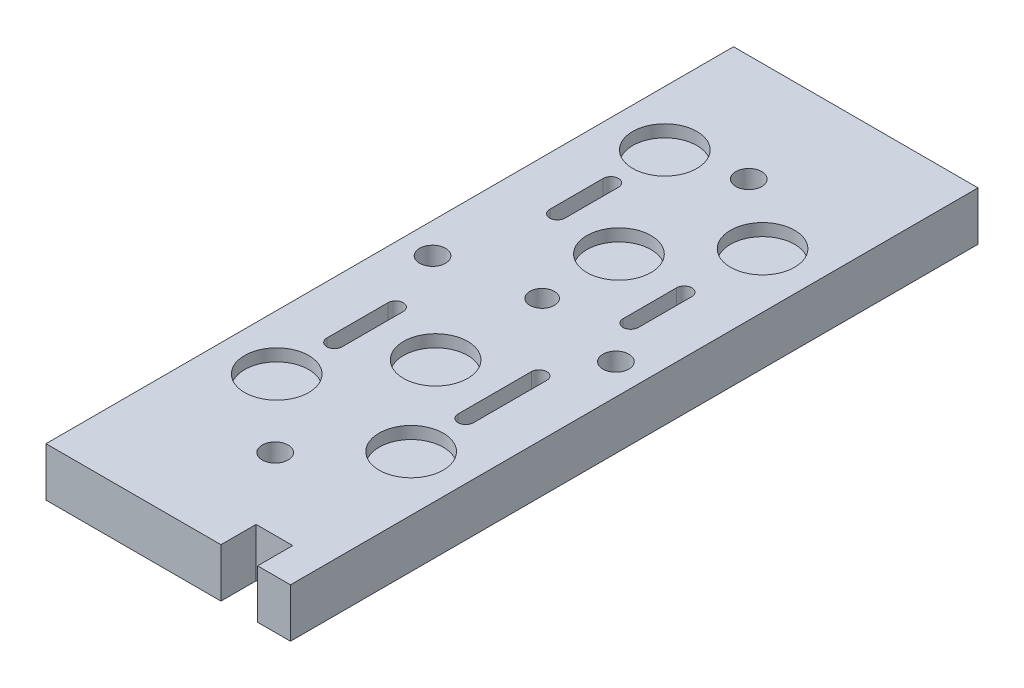
from build123d import *

# Parameters (mm, degrees)
SKETCH1_W           = 80
SKETCH1_H           = 225
BOSS_EXTRUDE1_DEPTH = 16
CUT_EXTRUDE1_REACH  = 122.467
SKETCH4_R           = 10.5
CUT_EXTRUDE2_DEPTH  = 4
SKETCH5_R           = 8.5
CUT_EXTRUDE3_DEPTH  = 5
CUT_EXTRUDE4_REACH  = 122.467
SKETCH6_W           = 12
SKETCH6_H           = 11.5
M10_TAPPED_HOLE1_D  = 8.5
CUT_EXTRUDE5_REACH  = 122.467
SKETCH10_R          = 4


with BuildPart() as part:
    # Sketch1 → Boss-Extrude1 (new body)
    with BuildSketch(Plane(origin=(0, 0, 0), x_dir=(1, 0, 0), z_dir=(0, 1, 0))):
        Rectangle(SKETCH1_W, SKETCH1_H)
    extrude(amount=-BOSS_EXTRUDE1_DEPTH)

    # Sketch2 → Cut-Extrude1 (cut, up to next)
    with BuildSketch(Plane(origin=(0, 0, 0), x_dir=(1, 0, 0), z_dir=(0, 1, 0)), mode=Mode.PRIVATE) as cut_extrude1_sk1:
        with BuildLine():
            Line((-19, 36.36), (-19, 53.86))
            ThreePointArc((-19, 53.86), (-21.5, 56.36), (-24, 53.86))
            Line((-24, 53.86), (-24, 36.36))
            ThreePointArc((-24, 36.36), (-21.5, 33.86), (-19, 36.36))
        make_face()
    cut_extrude1_tool1 = extrude(cut_extrude1_sk1.sketch, amount=-CUT_EXTRUDE1_REACH, mode=Mode.PRIVATE) & part.part
    # Sketch2 → Cut-Extrude1 (cut, up to next)
    with BuildSketch(Plane(origin=(0, 0, 0), x_dir=(1, 0, 0), z_dir=(0, 1, 0)), mode=Mode.PRIVATE) as cut_extrude1_sk2:
        with BuildLine():
            Line((-19, -36.59), (-19, -16.59))
            ThreePointArc((-19, -16.59), (-21.5, -14.09), (-24, -16.59))
            Line((-24, -16.59), (-24, -36.59))
            ThreePointArc((-24, -36.59), (-21.5, -39.09), (-19, -36.59))
        make_face()
    cut_extrude1_tool2 = extrude(cut_extrude1_sk2.sketch, amount=-CUT_EXTRUDE1_REACH, mode=Mode.PRIVATE) & part.part
    # Sketch2 → Cut-Extrude1 (cut, up to next)
    with BuildSketch(Plane(origin=(0, 0, 0), x_dir=(1, 0, 0), z_dir=(0, 1, 0)), mode=Mode.PRIVATE) as cut_extrude1_sk3:
        with BuildLine():
            Line((24, 17.36), (24, 34.86))
            ThreePointArc((24, 34.86), (21.5, 37.36), (19, 34.86))
            Line((19, 34.86), (19, 17.36))
            ThreePointArc((19, 17.36), (21.5, 14.86), (24, 17.36))
        make_face()
    cut_extrude1_tool3 = extrude(cut_extrude1_sk3.sketch, amount=-CUT_EXTRUDE1_REACH, mode=Mode.PRIVATE) & part.part
    # Sketch2 → Cut-Extrude1 (cut, up to next)
    with BuildSketch(Plane(origin=(0, 0, 0), x_dir=(1, 0, 0), z_dir=(0, 1, 0)), mode=Mode.PRIVATE) as cut_extrude1_sk4:
        with BuildLine():
            Line((24, -36.64), (24, -12.64))
            ThreePointArc((24, -12.64), (21.5, -10.14), (19, -12.64))
            Line((19, -12.64), (19, -36.64))
            ThreePointArc((19, -36.64), (21.5, -39.14), (24, -36.64))
        make_face()
    cut_extrude1_tool4 = extrude(cut_extrude1_sk4.sketch, amount=-CUT_EXTRUDE1_REACH, mode=Mode.PRIVATE) & part.part
    add(cut_extrude1_tool1.solids().sort_by_distance((-21.5, 0, -45.11))[0], mode=Mode.SUBTRACT)
    add(cut_extrude1_tool2.solids().sort_by_distance((-21.5, 0, 26.59))[0], mode=Mode.SUBTRACT)
    add(cut_extrude1_tool3.solids().sort_by_distance((21.5, 0, -26.11))[0], mode=Mode.SUBTRACT)
    add(cut_extrude1_tool4.solids().sort_by_distance((21.5, 0, 24.64))[0], mode=Mode.SUBTRACT)

    # Sketch4 → Cut-Extrude2 (cut)
    with BuildSketch(Plane(origin=(0, 0, 0), x_dir=(1, 0, 0), z_dir=(0, 1, 0))):
        with Locations((-22, 72)):
            Circle(SKETCH4_R)
        with Locations((22, 60)):
            Circle(SKETCH4_R)
        with Locations((0, 35)):
            Circle(SKETCH4_R)
        with Locations((0, -25)):
            Circle(SKETCH4_R)
        with Locations((22, -55)):
            Circle(SKETCH4_R)
        with Locations((-22, -55)):
            Circle(SKETCH4_R)
    extrude(amount=-CUT_EXTRUDE2_DEPTH, mode=Mode.SUBTRACT)

    # Sketch5 → Cut-Extrude3 (cut)
    with BuildSketch(Plane.XZ.offset(16)):
        with Locations((0, 100)):
            Circle(SKETCH5_R)
        with Locations((0, -100)):
            Circle(SKETCH5_R)
    extrude(amount=-CUT_EXTRUDE3_DEPTH, mode=Mode.SUBTRACT)

    # Sketch6 → Cut-Extrude4 (cut, up to next)
    with BuildSketch(Plane(origin=(0, 0, 0), x_dir=(1, 0, 0), z_dir=(0, 1, 0)), mode=Mode.PRIVATE) as cut_extrude4_sk1:
        with Locations((23.25, -106.75)):
            Rectangle(SKETCH6_W, SKETCH6_H)
    cut_extrude4_tool1 = extrude(cut_extrude4_sk1.sketch, amount=-CUT_EXTRUDE4_REACH, mode=Mode.PRIVATE) & part.part
    add(cut_extrude4_tool1.solids().sort_by_distance((23.25, 0, 106.75))[0], mode=Mode.SUBTRACT)

    # M10 Tapped Hole1 (through all)
    with Locations(Plane(origin=(0, 0, 0), x_dir=(1, 0, 0), z_dir=(0, 1, 0))):
        with Locations((0, -77.5), (30, 4), (-30, 4), (0, 77.5)):
            Hole(M10_TAPPED_HOLE1_D / 2)

    # Sketch10 → Cut-Extrude5 (cut, up to next)
    with BuildSketch(Plane(origin=(0, 0, 0), x_dir=(1, 0, 0), z_dir=(0, 1, 0)), mode=Mode.PRIVATE) as cut_extrude5_sk1:
        with Locations((0, 9.86)):
            Circle(SKETCH10_R)
    cut_extrude5_tool1 = extrude(cut_extrude5_sk1.sketch, amount=-CUT_EXTRUDE5_REACH, mode=Mode.PRIVATE) & part.part
    add(cut_extrude5_tool1.solids().sort_by_distance((0, 0, -9.86))[0], mode=Mode.SUBTRACT)


solid = part.part
